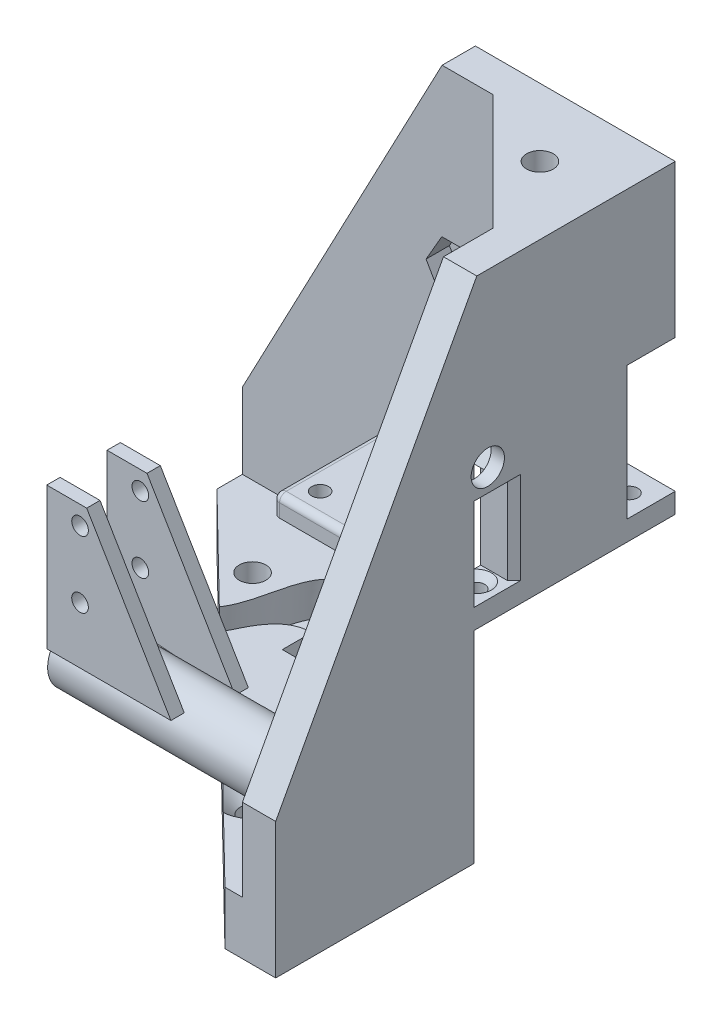
from build123d import *

# Parameters (mm, degrees)
SKETCH1_R                      = 2
BOSS_EXTRUDE1_DEPTH            = 8
BOSS_EXTRUDE3_START            = -8
BOSS_EXTRUDE3_DEPTH            = 76.2
CUT_EXTRUDE1_REACH             = 91.001
SKETCH4_W                      = 29.21
SKETCH4_H                      = 29.21
CUT_EXTRUDE1_DIRECTION_2_DEPTH = 22.3
CUT_EXTRUDE2_START             = -3
SKETCH5_W                      = 6.21
SKETCH5_H                      = 5
SKETCH5_W_2                    = 5
SKETCH5_H_2                    = 6.21
CUT_EXTRUDE2_DEPTH             = 20
CUT_EXTRUDE3_REACH             = 75.326
SKETCH6_R                      = 1.25
CHAMFER1_SIZE                  = 1
CUT_EXTRUDE4_REACH             = 102.097
CUT_EXTRUDE5_REACH             = 106.467
SKETCH9_R                      = 1.25
BOSS_EXTRUDE4_DEPTH            = 3
FILLET2_R                      = 1
SKETCH10_R                     = 11.5
CUT_EXTRUDE6_DEPTH             = 3
SKETCH12_R                     = 4.6
SKETCH12_R_2                   = 2.6
BOSS_EXTRUDE5_DEPTH            = 35.56
FILLET3_R                      = 1
CHAMFER2_SIZE                  = 1
BOSS_EXTRUDE6_REACH            = 109.184
SKETCH14_W                     = 12.395863616
SKETCH14_H                     = 10.34969721
SKETCH13_R                     = 2.5
CUT_EXTRUDE7_DEPTH             = 20
CUT_EXTRUDE8_DEPTH             = 3
BOSS_EXTRUDE7_START            = -0.81
BOSS_EXTRUDE7_DEPTH            = 6
BOSS_EXTRUDE8_DEPTH            = 2
BOSS_EXTRUDE9_REACH            = 97.245
CUT_EXTRUDE9_REACH             = 101.894
SKETCH19_R                     = 1.25
SKETCH20_W                     = 5
SKETCH20_H                     = 17.5
CUT_EXTRUDE10_DEPTH            = 8
BOSS_EXTRUDE10_DEPTH           = 3
CUT_EXTRUDE11_DEPTH            = 96.269973119
CHAMFER3_SIZE                  = 3
BOSS_EXTRUDE11_REACH           = 104.929
SKETCH23_W                     = 11.738766733
SKETCH23_H                     = 8.191368107
SKETCH23_R                     = 2.5
SKETCH25_R                     = 2.5
CUT_EXTRUDE12_DEPTH            = 103.928941231
CUT_EXTRUDE13_START            = -3.5
SKETCH26_R                     = 2.5
CUT_EXTRUDE13_DEPTH            = 3.5
SKETCH27_R                     = 2
BOSS_EXTRUDE12_DEPTH           = 7
CUT_EXTRUDE14_START            = -3.5
SKETCH29_R                     = 2
CUT_EXTRUDE14_DEPTH            = 3.5


with BuildPart() as part:
    # Sketch1 → Boss-Extrude1 (new body)
    with BuildSketch(Plane(origin=(0, 0, 0), x_dir=(1, 0, 0), z_dir=(0, 1, 0))):
        Polygon((-34.466315789, 14.371052632), (-34.466315789, 5.547894737), (17.913684211, -45.628947368), (25.533684211, -45.628947368), (25.533684211, 14.371052632), align=None)
        with Locations(Location((7.652084211, -31.069547368, 0), (0, 0, 270))):
            Circle(SKETCH1_R, mode=Mode.SUBTRACT)
        with Locations(Location((-20.922915789, -2.646947368, 0), (0, 0, 270))):
            Circle(SKETCH1_R, mode=Mode.SUBTRACT)
    extrude(amount=BOSS_EXTRUDE1_DEPTH)

    # Sketch3 → Boss-Extrude3 (add)
    with BuildSketch(Plane(origin=(0, 8, 0), x_dir=(1, 0, 0), z_dir=(0, 1, 0)).offset(BOSS_EXTRUDE3_START)):
        Polygon((-34.466315789, 14.371052632), (-34.466315789, 9.371052632), (20.533684211, 9.371052632), (20.533684211, -45.628947368), (25.533684211, -45.628947368), (25.533684211, 14.371052632), align=None)
    extrude(amount=BOSS_EXTRUDE3_DEPTH)

    # Sketch4 → Cut-Extrude1 (cut, up to next)
    with BuildSketch(Plane(origin=(0, 8, 0), x_dir=(1, 0, 0), z_dir=(0, 1, 0)), mode=Mode.PRIVATE) as cut_extrude1_sk1:
        with Locations((10.928684211, -0.233947368)):
            Rectangle(SKETCH4_W, SKETCH4_H)
    cut_extrude1_tool1 = extrude(cut_extrude1_sk1.sketch, amount=-CUT_EXTRUDE1_REACH, mode=Mode.PRIVATE) & part.part
    add(cut_extrude1_tool1.solids().sort_by_distance((10.928684, 8, 0.233947))[0], mode=Mode.SUBTRACT)

    # Sketch4 → Cut-Extrude1 direction 2 (cut)
    with BuildSketch(Plane(origin=(0, 8, 0), x_dir=(1, 0, 0), z_dir=(0, 1, 0))):
        with Locations((10.928684211, -0.233947368)):
            Rectangle(SKETCH4_W, SKETCH4_H)
    extrude(amount=CUT_EXTRUDE1_DIRECTION_2_DEPTH, mode=Mode.SUBTRACT)

    # Sketch5 → Cut-Extrude2 (cut)
    with BuildSketch(Plane.XZ.offset(-30.3).offset(CUT_EXTRUDE2_START)):
        with Locations((22.428684211, 12.338947368)):
            Rectangle(SKETCH5_W, SKETCH5_H)
        with Locations((-1.176315789, -11.266052632)):
            Rectangle(SKETCH5_W_2, SKETCH5_H_2)
        with Locations((22.428684211, -11.266052632)):
            Rectangle(SKETCH5_W, SKETCH5_H_2)
    extrude(amount=-CUT_EXTRUDE2_DEPTH, mode=Mode.SUBTRACT)

    # Sketch6 → Cut-Extrude3 (cut, up to next)
    with BuildSketch(Plane.XZ.offset(-30.3), mode=Mode.PRIVATE) as cut_extrude3_sk1:
        with Locations(Location((22.323684211, 12.288947368, 0), (0, 0, 270))):
            Circle(SKETCH6_R)
    cut_extrude3_tool1 = extrude(cut_extrude3_sk1.sketch, amount=-CUT_EXTRUDE3_REACH, mode=Mode.PRIVATE) & part.part
    # Sketch6 → Cut-Extrude3 (cut, up to next)
    with BuildSketch(Plane.XZ.offset(-30.3), mode=Mode.PRIVATE) as cut_extrude3_sk2:
        with Locations(Location((22.323684211, -10.711052632, 0), (0, 0, 270))):
            Circle(SKETCH6_R)
    cut_extrude3_tool2 = extrude(cut_extrude3_sk2.sketch, amount=-CUT_EXTRUDE3_REACH, mode=Mode.PRIVATE) & part.part
    # Sketch6 → Cut-Extrude3 (cut, up to next)
    with BuildSketch(Plane.XZ.offset(-30.3), mode=Mode.PRIVATE) as cut_extrude3_sk3:
        with Locations(Location((-0.676315789, -10.711052632, 0), (0, 0, 270))):
            Circle(SKETCH6_R)
    cut_extrude3_tool3 = extrude(cut_extrude3_sk3.sketch, amount=-CUT_EXTRUDE3_REACH, mode=Mode.PRIVATE) & part.part
    add(cut_extrude3_tool1.solids().sort_by_distance((22.323684, 30.3, 12.288947))[0], mode=Mode.SUBTRACT)
    add(cut_extrude3_tool2.solids().sort_by_distance((22.323684, 30.3, -10.711053))[0], mode=Mode.SUBTRACT)
    add(cut_extrude3_tool3.solids().sort_by_distance((-0.676316, 30.3, -10.711053))[0], mode=Mode.SUBTRACT)

    # Chamfer1
    chamfer1_edges = [part.edges().sort_by_distance(p)[0] for p in [
        (19.323684211, 43.3, -14.371052632),
        (25.533684211, 43.3, -8.161052632),
        (-3.676315789, 43.3, -14.371052632),
        (1.323684211, 43.3, -14.371052632),
        (25.533684211, 15.15, 14.838947368),
        (-3.676315789, 15.15, -14.371052632),
        (25.533684211, 43.3, 9.838947368),
        (25.533684211, 43.3, 14.838947368),
    ]]
    chamfer(chamfer1_edges, length=CHAMFER1_SIZE)

    # Sketch7 → Cut-Extrude4 (cut, up to next)
    with BuildSketch(Plane.XY.offset(-9.371052632), mode=Mode.PRIVATE) as cut_extrude4_sk1:
        Polygon((-4.478138481, 76.2), (-34.466315789, 19.345490892), (-34.466315789, 76.2), align=None)
    cut_extrude4_tool1 = extrude(cut_extrude4_sk1.sketch, amount=-CUT_EXTRUDE4_REACH, mode=Mode.PRIVATE) & part.part
    add(cut_extrude4_tool1.solids().sort_by_distance((-24.470257, 57.248497, -9.371053))[0], mode=Mode.SUBTRACT)

    # Sketch8 → Cut-Extrude5 (cut, up to next)
    with BuildSketch(Plane.ZY.offset(-20.533684211), mode=Mode.PRIVATE) as cut_extrude5_sk1:
        Polygon((45.628947368, 76.2), (15.432121686, 76.2), (45.628947368, 20.360875822), align=None)
    cut_extrude5_tool1 = extrude(cut_extrude5_sk1.sketch, amount=-CUT_EXTRUDE5_REACH, mode=Mode.PRIVATE) & part.part
    add(cut_extrude5_tool1.solids().sort_by_distance((20.533684, 57.586959, 35.563339))[0], mode=Mode.SUBTRACT)

    # Sketch9 → Boss-Extrude4 (add)
    with BuildSketch(Plane.XZ.offset(-30.3)):
        with BuildLine():
            Line((-4.676315789, 15.838947368), (-4.676315789, -14.371052632))
            Line((-4.676315789, -14.371052632), (0.900761385, -14.371052632))
            ThreePointArc((0.900761385, -14.371052632), (0.366362818, -13.109171958), (-0.102099011, -11.821356685))
            ThreePointArc((-0.102099011, -11.821356685), (-1.878735883, -11.052645838), (-0.771600032, -9.464689557))
            ThreePointArc((-0.771600032, -9.464689557), (-1.228222209, 0.185593043), (1.804207587, 9.358423992))
            ThreePointArc((1.804207587, 9.358423992), (11.255772005, 12.427491579), (21.173303455, 11.799944181))
            ThreePointArc((21.173303455, 11.799944181), (22.678913505, 13.487409779), (23.021780943, 11.252047686))
            ThreePointArc((23.021780943, 11.252047686), (24.290349599, 10.788966069), (25.533684211, 10.261870194))
            Line((25.533684211, 10.261870194), (25.533684211, 15.838947368))
            Line((25.533684211, 15.838947368), (-4.676315789, 15.838947368))
        make_face()
        with Locations(Location((-1.126315789, 12.288947368, 0), (0, 0, 270))):
            Circle(SKETCH9_R, mode=Mode.SUBTRACT)
    extrude(amount=-BOSS_EXTRUDE4_DEPTH)

    # Fillet2
    fillet2_edges = [part.edges().sort_by_distance(p)[0] for p in [
        (7.928684211, 33.3, 15.838947368),
        (-4.676315789, 33.3, 3.233947368),
        (-4.676315789, 31.8, 15.838947368),
        (-0.793400855, 31.8, -9.371052632),
    ]]
    fillet(fillet2_edges, radius=FILLET2_R)

    # Sketch10 → Cut-Extrude6 (cut)
    with BuildSketch(Plane.XZ.offset(-30.3)):
        with Locations((10.823684211, 0.788947368)):
            Circle(SKETCH10_R)
    extrude(amount=-CUT_EXTRUDE6_DEPTH, mode=Mode.SUBTRACT)

    # Sketch12 → Boss-Extrude5 (add)
    with BuildSketch(Plane.ZY.offset(-20.533684211)):
        with Locations(Location((34.718947368, 16.95, 0), (0, 0, 180))):
            Circle(SKETCH12_R)
        with Locations(Location((34.718947368, 16.95, 0), (0, 0, 180))):
            Circle(SKETCH12_R_2, mode=Mode.SUBTRACT)
    extrude(amount=BOSS_EXTRUDE5_DEPTH)

    # Fillet3
    fillet3_edges = [part.edges().sort_by_distance(p)[0] for p in [
        (-15.026315789, 16.95, 37.318947368),
    ]]
    fillet(fillet3_edges, radius=FILLET3_R)

    # Chamfer2
    # the kernel refuses this chamfer: 1 mm, written as the material it takes off along each edge
    with BuildSketch(Plane(origin=(22.323684211, 33.3, 12.288947368), x_dir=(-0.9203046044214335, 0, -0.3912025499414705), z_dir=(0.3912025499414705, 0, -0.9203046044214335))) as chamfer2_piece_1:
        Polygon((1.25 + CHAMFER2_SIZE, 0), (1.25, -CHAMFER2_SIZE), (1.25, 0), align=None)
    revolve(axis=Axis((22.323684211, 33.3, 12.288947368), (0, 1, 0)), revolution_arc=259.078782156, mode=Mode.SUBTRACT)
    with BuildSketch(Plane(origin=(-0.676315789, 33.3, -10.711052632), x_dir=(0, 0, -1), z_dir=(-1, 0, 0))) as chamfer2_piece_2_section:
        Polygon((1.25 + CHAMFER2_SIZE, 0), (1.25, CHAMFER2_SIZE), (1.25, 0), align=None)
    chamfer2_piece_2 = revolve(axis=Axis((-0.676315789, 33.3, -10.711052632), (0, -1, 0)), mode=Mode.PRIVATE)
    chamfer2_piece_2 = split(chamfer2_piece_2, bisect_by=Plane(origin=(1.323684211, 32.812414485, -8.973467116), z_dir=(-1, 0, 0)), keep=Keep.TOP, mode=Mode.PRIVATE)
    add(chamfer2_piece_2, mode=Mode.SUBTRACT)
    with BuildSketch(Plane(origin=(22.323684211, 33.3, 12.288947368), x_dir=(-0.920304604421433, 0, -0.39120254994147174), z_dir=(-0.39120254994147174, 0, 0.920304604421433))) as chamfer2_piece_3:
        Polygon((1.25 + CHAMFER2_SIZE, 0), (1.25, CHAMFER2_SIZE), (1.25, 0), align=None)
    revolve(axis=Axis((22.323684211, 33.3, 12.288947368), (0, -1, 0)), revolution_arc=66.970653716, mode=Mode.SUBTRACT)
    with BuildSketch(Plane(origin=(22.323684211, 33.3, 12.288947368), x_dir=(0, 0, -1), z_dir=(-1, 0, 0))) as chamfer2_piece_4:
        Polygon((1.25 + CHAMFER2_SIZE, 0), (1.25, CHAMFER2_SIZE), (1.25, 0), align=None)
    revolve(axis=Axis((22.323684211, 33.3, 12.288947368), (0, -1, 0)), revolution_arc=33.950564129, mode=Mode.SUBTRACT)

    # Boss-Extrude6: up to this face of the body (flat: up to its plane)
    boss_extrude6_end = Plane(part.part.faces().sort_by_distance((20.533684211, 42.73772501, 15.512977944))[0])
    # Sketch14 → Boss-Extrude6 (add, up to the picked face)
    with BuildSketch(Plane(origin=(25.533684211, 0, 0), x_dir=(0, 0, -1), z_dir=(1, 0, 0)), mode=Mode.PRIVATE) as boss_extrude6_sk1:
        with Locations((-13.255996287, 52.297099972)):
            Rectangle(SKETCH14_W, SKETCH14_H)
    boss_extrude6_tool1 = split(extrude(boss_extrude6_sk1.sketch, amount=-BOSS_EXTRUDE6_REACH, mode=Mode.PRIVATE), bisect_by=boss_extrude6_end, keep=Keep.BOTH, mode=Mode.PRIVATE)
    add(boss_extrude6_tool1.solids().sort_by(Axis((25.533684, 52.2971, 13.255996), (-1, 0, 0)))[0])

    # Sketch13 → Cut-Extrude7 (cut)
    with BuildSketch(Plane(origin=(25.533684211, 0, 0), x_dir=(0, 0, -1), z_dir=(1, 0, 0))):
        with Locations((-13.782947368, 50.506)):
            Circle(SKETCH13_R)
    extrude(amount=-CUT_EXTRUDE7_DEPTH, mode=Mode.SUBTRACT)

    # Sketch15 → Cut-Extrude8 (cut)
    with BuildSketch(Plane.ZY.offset(-20.533684211)):
        Polygon((16.150083472, 46.406), (18.517219576, 50.506), (16.150083472, 54.606), (11.415811265, 54.606), (9.048675161, 50.506), (11.415811265, 46.406), align=None)
    extrude(amount=-CUT_EXTRUDE8_DEPTH, mode=Mode.SUBTRACT)

    # Sketch16 → Boss-Extrude7 (add)
    with BuildSketch(Plane.ZY.offset(15.026315789).offset(BOSS_EXTRUDE7_START)):
        Polygon((29.205270784, 20.25), (29.205270784, 41.55), (31.205270784, 41.55), (31.205270784, 21.55), (34.732122234, 21.55), (38.258973684, 21.55), (38.258973684, 41.55), (40.258973684, 41.55), (40.258973684, 20.25), align=None)
    extrude(amount=-BOSS_EXTRUDE7_DEPTH)

    # Sketch17 → Boss-Extrude8 (add)
    with BuildSketch(Plane.XY.offset(40.258973684)):
        Polygon((-8.216315789, 41.55), (4.433684211, 20.25), (-8.216315789, 20.25), align=None)
    extrude(amount=-BOSS_EXTRUDE8_DEPTH)

    # Boss-Extrude9: up to this face of the body (flat: up to its plane)
    boss_extrude9_end = Plane(part.part.faces().sort_by_distance((-11.216315789, 30.9, 29.205270784))[0])
    # Sketch18 → Boss-Extrude9 (add, up to the picked face)
    with BuildSketch(Plane.XY.offset(31.205270784), mode=Mode.PRIVATE) as boss_extrude9_sk1:
        Polygon((5.005344556, 19.287441473), (-8.216315789, 41.55), (-8.216315789, 21.55), (-8.216315789, 20.25), align=None)
    boss_extrude9_tool1 = split(extrude(boss_extrude9_sk1.sketch, amount=-BOSS_EXTRUDE9_REACH, mode=Mode.PRIVATE), bisect_by=boss_extrude9_end, keep=Keep.BOTH, mode=Mode.PRIVATE)
    add(boss_extrude9_tool1.solids().sort_by(Axis((-3.809096, 27.029147, 31.205271), (0, 0, -1)))[0])

    # Cut-Extrude9: up to this face of the body (flat: up to its plane)
    cut_extrude9_end = Plane(part.part.faces().sort_by_distance((-3.809095674, 27.029147158, 29.205270784))[0])
    # Sketch19 → Cut-Extrude9 (cut, up to the picked face)
    with BuildSketch(Plane.XY.offset(40.258973684), mode=Mode.PRIVATE) as cut_extrude9_sk1:
        with Locations((-9.216315789, 38.75)):
            Circle(SKETCH19_R)
    cut_extrude9_tool1 = split(extrude(cut_extrude9_sk1.sketch, amount=-CUT_EXTRUDE9_REACH, mode=Mode.PRIVATE), bisect_by=cut_extrude9_end, keep=Keep.BOTH, mode=Mode.PRIVATE)
    # Sketch19 → Cut-Extrude9 (cut, up to the picked face)
    with BuildSketch(Plane.XY.offset(40.258973684), mode=Mode.PRIVATE) as cut_extrude9_sk2:
        with Locations((-9.216315789, 28.75)):
            Circle(SKETCH19_R)
    cut_extrude9_tool2 = split(extrude(cut_extrude9_sk2.sketch, amount=-CUT_EXTRUDE9_REACH, mode=Mode.PRIVATE), bisect_by=cut_extrude9_end, keep=Keep.BOTH, mode=Mode.PRIVATE)
    add(cut_extrude9_tool1.solids().sort_by(Axis((-9.216316, 38.75, 40.258974), (0, 0, -1)))[0], mode=Mode.SUBTRACT)
    add(cut_extrude9_tool2.solids().sort_by(Axis((-9.216316, 28.75, 40.258974), (0, 0, -1)))[0], mode=Mode.SUBTRACT)

    # Sketch20 → Cut-Extrude10 (cut)
    with BuildSketch(Plane(origin=(0, 8, 0), x_dir=(1, 0, 0), z_dir=(0, 1, 0))):
        with Locations((-6.176315789, -1.673589448)):
            Rectangle(SKETCH20_W, SKETCH20_H)
        with BuildLine():
            Line((-18.966078387, -9.59630538), (-15.656593848, -12.829771736))
            add(Edge.make_bspline(
                [(-8.676315789, -5.979416788), (-12.804300837, -6.065478607), (-14.157484209, -9.839454548), (-15.656593848, -12.829771736)],
                knots=[0, 0, 0, 0, 1, 1, 1, 1], degree=3))
            Line((-8.676315789, -5.979416788), (-8.676315789, 4.020583212))
            add(Edge.make_bspline(
                [(-8.676315789, 4.020583212), (-18.024476716, 4.401439403), (-15.579825994, -4.507510719), (-18.966078387, -9.59630538)],
                knots=[0, 0, 0, 0, 1, 1, 1, 1], degree=3))
        make_face()
    extrude(amount=-CUT_EXTRUDE10_DEPTH, mode=Mode.SUBTRACT)

    # Sketch21 → Boss-Extrude10 (add)
    with BuildSketch(Plane.XZ):
        with BuildLine():
            add(Edge.make_bspline(
                [(-15.656593848, 12.829771736), (-14.307022415, 10.137742717), (-13.075716581, 6.810599313), (-9.831700407, 6.110820738)],
                knots=[0, 0, 0, 0, 0.900248653, 0.900248653, 0.900248653, 0.900248653], degree=3))
            Line((-15.656593848, 12.829771736), (-18.966078387, 9.59630538))
            add(Edge.make_bspline(
                [(-12.356774478, -3.533514321), (-17.386973046, -1.623682287), (-16.126665832, 5.329291061), (-18.966078387, 9.59630538)],
                knots=[0.16148821, 0.16148821, 0.16148821, 0.16148821, 1, 1, 1, 1], degree=3))
            Line((-12.356774478, -3.533514321), (-9.831700407, 6.110820738))
        make_face()
    extrude(amount=-BOSS_EXTRUDE10_DEPTH)

    # Sketch22 → Cut-Extrude11 (cut, through all)
    with BuildSketch(Plane.XZ):
        with BuildLine():
            Line((5.769315401, 31.74421885), (9.53485302, 31.74421885))
            ThreePointArc((9.53485302, 31.74421885), (7.652084211, 29.069547368), (5.769315401, 31.74421885))
        make_face()
    extrude(amount=-CUT_EXTRUDE11_DEPTH, mode=Mode.SUBTRACT)

    # Chamfer3
    # the kernel refuses this chamfer: 3 mm, written as the material it takes off along each edge
    with BuildSketch(Plane(origin=(7.652084211, 8, 31.069547368), x_dir=(0, 0, 1), z_dir=(-1, 0, 0))) as chamfer3_piece_1:
        Polygon((2 + CHAMFER3_SIZE, 0), (2, -CHAMFER3_SIZE), (2, 0), align=None)
    revolve(axis=Axis((7.652084211, 8, 31.069547368), (0, 1, 0)), revolution_arc=70.285364111, mode=Mode.SUBTRACT)
    with BuildSketch(Plane(origin=(7.652084211, 8, 31.069547368), x_dir=(-0.9413844049810138, 0, 0.3373357408555204), z_dir=(-0.3373357408555204, 0, -0.9413844049810138))) as chamfer3_piece_2:
        Polygon((2 + CHAMFER3_SIZE, 0), (2, -CHAMFER3_SIZE), (2, 0), align=None)
    revolve(axis=Axis((7.652084211, 8, 31.069547368), (0, 1, 0)), revolution_arc=70.285364111, mode=Mode.SUBTRACT)
    with BuildSketch(Plane(origin=(7.652084211, 8, 31.069547368), x_dir=(0.9413844049810061, 0, 0.3373357408555418), z_dir=(-0.3373357408555418, 0, 0.9413844049810061))) as chamfer3_piece_3:
        Polygon((2 + CHAMFER3_SIZE, 0), (2, -CHAMFER3_SIZE), (2, 0), align=None)
    revolve(axis=Axis((7.652084211, 8, 31.069547368), (0, 1, 0)), revolution_arc=219.429271779, mode=Mode.SUBTRACT)

    # Boss-Extrude11: up to this face of the body (flat: up to its plane)
    boss_extrude11_end = Plane(part.part.faces().sort_by_distance((-4.800961615, 42.012007747, -9.371052632))[0])
    # Sketch23 → Boss-Extrude11 (add, up to the picked face)
    with BuildSketch(Plane(origin=(0, 0, -14.371052632), x_dir=(-1, 0, 0), z_dir=(0, 0, -1)), mode=Mode.PRIVATE) as boss_extrude11_sk1:
        with Locations((1.345154659, 50.434175573)):
            Rectangle(SKETCH23_W, SKETCH23_H)
        with Locations((2.152315789, 49.784)):
            Circle(SKETCH23_R, mode=Mode.SUBTRACT)
    boss_extrude11_tool1 = split(extrude(boss_extrude11_sk1.sketch, amount=-BOSS_EXTRUDE11_REACH, mode=Mode.PRIVATE), bisect_by=boss_extrude11_end, keep=Keep.BOTH, mode=Mode.PRIVATE)
    add(boss_extrude11_tool1.solids().sort_by(Axis((-1.345155, 54.386717, -14.371053), (0, 0, 1)))[0])

    # Sketch25 → Cut-Extrude12 (cut, through all)
    with BuildSketch(Plane(origin=(0, 0, -14.371052632), x_dir=(-1, 0, 0), z_dir=(0, 0, -1))):
        with Locations((2.152315789, 49.784)):
            Circle(SKETCH25_R)
    extrude(amount=-CUT_EXTRUDE12_DEPTH, mode=Mode.SUBTRACT)

    # Sketch26 → Cut-Extrude13 (cut)
    with BuildSketch(Plane.XY.offset(-9.371052632).offset(CUT_EXTRUDE13_START)):
        Polygon((0.214820314, 45.684), (2.581956418, 49.784), (0.214820314, 53.884), (-4.519451893, 53.884), (-6.886587997, 49.784), (-4.519451893, 45.684), align=None)
        with Locations(Location((-2.152315789, 49.784, 0), (0, 0, 180))):
            Circle(SKETCH26_R, mode=Mode.SUBTRACT)
    extrude(amount=CUT_EXTRUDE13_DEPTH, mode=Mode.SUBTRACT)

    # Sketch27 → Boss-Extrude12 (add)
    with BuildSketch(Plane(origin=(0, 76.2, 0), x_dir=(1, 0, 0), z_dir=(0, 1, 0))):
        Polygon((-1.800511962, 14.371052632), (25.533684211, -12.963143541), (25.533684211, 14.371052632), align=None)
        with Locations(Location((15.373684211, 4.211052632, 0), (0, 0, 270))):
            Circle(SKETCH27_R, mode=Mode.SUBTRACT)
    extrude(amount=-BOSS_EXTRUDE12_DEPTH)

    # Sketch29 → Cut-Extrude14 (cut)
    with BuildSketch(Plane.XZ.offset(-69.2).offset(CUT_EXTRUDE14_START)):
        Polygon((17.394410153, -0.711052632), (13.352958268, -0.711052632), (11.332232326, -4.211052632), (13.352958268, -7.711052632), (17.394410153, -7.711052632), (19.415136095, -4.211052632), align=None)
        with Locations(Location((15.373684211, -4.211052632, 0), (0, 0, 90))):
            Circle(SKETCH29_R, mode=Mode.SUBTRACT)
    extrude(amount=CUT_EXTRUDE14_DEPTH, mode=Mode.SUBTRACT)


solid = part.part
